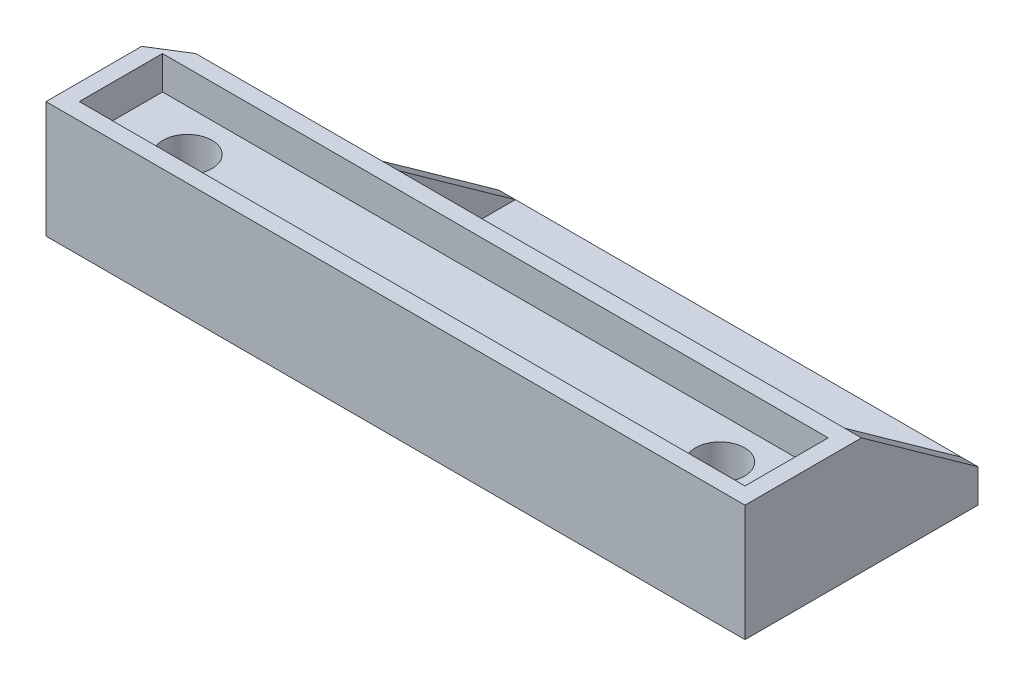
from build123d import *

# Parameters (mm, degrees)
RISER_DEPTH             = 7
SKETCH2_R               = 1.475
MOUNTING_HOLES_DEPTH    = 44.150898021
SKETCH3_W               = 40
SKETCH3_H               = 5
RECESS_DEPTH            = 2
FLANGE_DEPTH            = 7
SKETCH5_W               = 26.797240136
SKETCH5_H               = 7
FLANGE_CUTOUT_DEPTH     = 5
ANGLE_CUTOUT_DEPTH      = 44.886216515
ANGLE_CUTOUT_DEPTH_BACK = 44.886216515
FLANGE_CHAMFER_1_SIZE   = 1
FLANGE_CHAMFER_2_SIZE   = 1


with BuildPart() as part:
    # Sketch1 → Riser (new body)
    with BuildSketch(Plane(origin=(0, 0, 0), x_dir=(1, 0, 0), z_dir=(0, 1, 0))):
        Polygon((2.000418161, 7), (42, 7), (42, 0), (0, 0), (0, 5.75), align=None)
    extrude(amount=RISER_DEPTH)

    # Sketch2 → Mounting Holes (cut, through all)
    with BuildSketch(Plane.XZ):
        with Locations((37, -3.5)):
            Circle(SKETCH2_R)
        with Locations((5, -3.5)):
            Circle(SKETCH2_R)
    extrude(amount=-MOUNTING_HOLES_DEPTH, mode=Mode.SUBTRACT)

    # Sketch3 → Recess (cut)
    with BuildSketch(Plane(origin=(0, 7, 0), x_dir=(1, 0, 0), z_dir=(0, 1, 0))):
        with Locations((21, 3.5)):
            Rectangle(SKETCH3_W, SKETCH3_H)
    extrude(amount=-RECESS_DEPTH, mode=Mode.SUBTRACT)

    # Sketch4 → Flange (add)
    with BuildSketch(Plane(origin=(0, 0, 0), x_dir=(1, 0, 0), z_dir=(0, 1, 0))):
        Polygon((2.000418161, 7), (42, 7), (42, 14), (13.202759864, 14), align=None)
    extrude(amount=FLANGE_DEPTH)

    # Sketch5 → Flange Cutout (cut)
    with BuildSketch(Plane(origin=(0, 7, 0), x_dir=(1, 0, 0), z_dir=(0, 1, 0))):
        with Locations((27.601379932, 10.5)):
            Rectangle(SKETCH5_W, SKETCH5_H)
        Polygon((2.000418161, 7), (13.202759864, 7), (13.202759864, 14), align=None)
    extrude(amount=-FLANGE_CUTOUT_DEPTH, mode=Mode.SUBTRACT)

    # Sketch7 → Angle Cutout (cut, two sides: drawn at the far end of the back side and taken through both)
    with BuildSketch(Plane.ZY.offset(-41).offset(-ANGLE_CUTOUT_DEPTH_BACK)):
        Polygon((-7, 7), (-14, 2), (-14, 7), align=None)
    extrude(amount=ANGLE_CUTOUT_DEPTH + ANGLE_CUTOUT_DEPTH_BACK, mode=Mode.SUBTRACT)

    # Flange Chamfer 1
    flange_chamfer_1_edges = [part.edges().sort_by_distance(p)[0] for p in [
        (27.601379932, 2, -7),
    ]]
    chamfer(flange_chamfer_1_edges, length=FLANGE_CHAMFER_1_SIZE)

    # Flange Chamfer 2
    flange_chamfer_2_edges = [part.edges().sort_by_distance(p)[0] for p in [
        (7.601589013, 2, -7),
    ]]
    chamfer(flange_chamfer_2_edges, length=FLANGE_CHAMFER_2_SIZE)


solid = part.part
